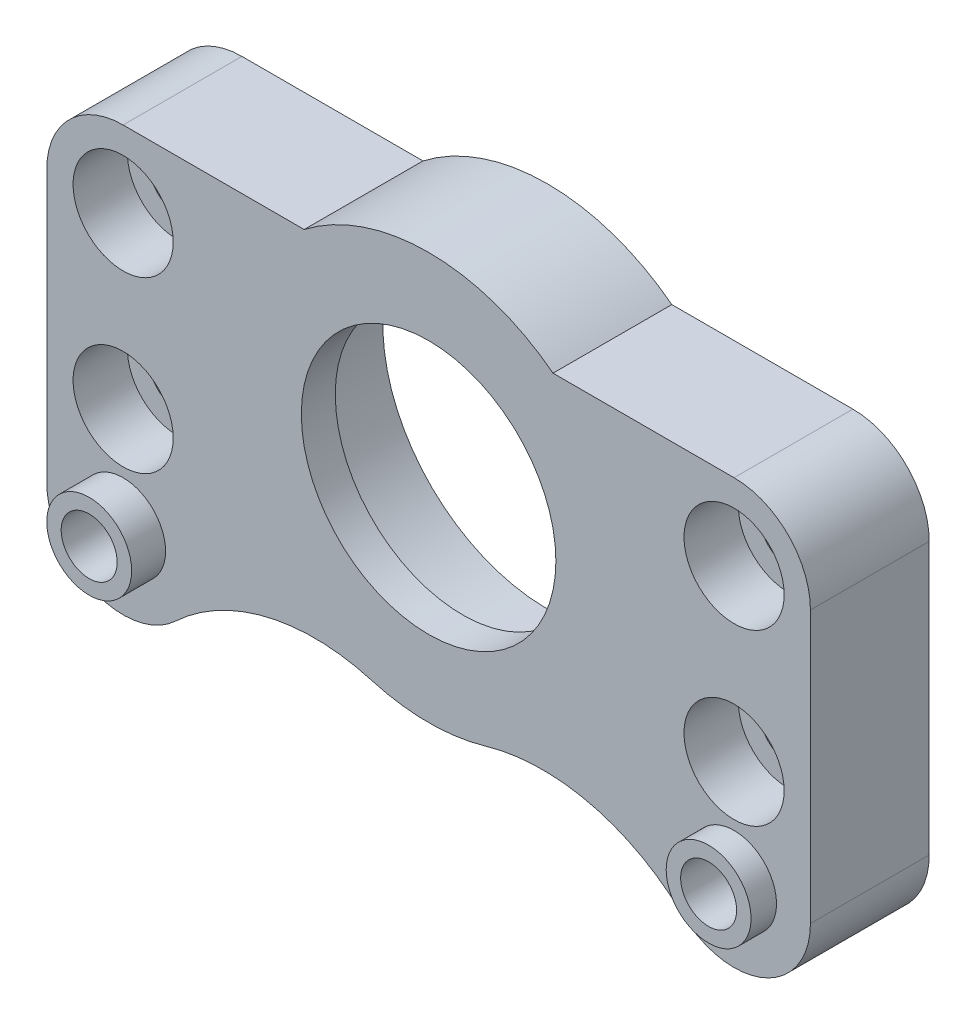
from build123d import *

# Parameters (mm, degrees)
SKETCH2_R           = 1.65
BOSS_EXTRUDE1_DEPTH = 7
SKETCH3_R           = 9.7
CUT_EXTRUDE1_DEPTH  = 5
SKETCH4_R           = 7.5
CUT_EXTRUDE2_DEPTH  = 5
CUT_EXTRUDE3_DEPTH  = 2.5
SKETCH8_R           = 2.95
CUT_EXTRUDE4_DEPTH  = 3.2
SKETCH9_R           = 2.5
SKETCH9_R_2         = 1.65
BOSS_EXTRUDE2_DEPTH = 1.5
MOVE_FACE1_BY       = 0.5


with BuildPart() as part:
    # Sketch2 → Boss-Extrude1 (new body)
    with BuildSketch(Plane.XY):
        with BuildLine():
            Line((-7.331439149, 9.5), (-18, 9.5))
            ThreePointArc((-18, 9.5), (-21.181980515, 8.181980515), (-22.5, 5))
            Line((-22.5, 5), (-22.5, -11))
            ThreePointArc((-22.5, -11), (-19.789453748, -15.128904853), (-14.92317543, -14.283770784))
            ThreePointArc((-14.92317543, -14.283770784), (-9.507484415, -11.369138817), (-3.359154955, -11.520246438))
            ThreePointArc((-3.359154955, -11.520246438), (0, -12), (3.359154955, -11.520246438))
            ThreePointArc((3.359154955, -11.520246438), (9.507484415, -11.369138817), (14.92317543, -14.283770784))
            ThreePointArc((14.92317543, -14.283770784), (19.789453748, -15.128904853), (22.5, -11))
            Line((22.5, -11), (22.5, 5))
            ThreePointArc((22.5, 5), (21.181980515, 8.181980515), (18, 9.5))
            Line((18, 9.5), (7.331439149, 9.5))
            ThreePointArc((7.331439149, 9.5), (0, 12), (-7.331439149, 9.5))
        make_face()
        with Locations((-18, 5)):
            Circle(SKETCH2_R, mode=Mode.SUBTRACT)
        with Locations((-18, -11)):
            Circle(SKETCH2_R, mode=Mode.SUBTRACT)
        with Locations((-18, -5)):
            Circle(SKETCH2_R, mode=Mode.SUBTRACT)
        with Locations((18, -5)):
            Circle(SKETCH2_R, mode=Mode.SUBTRACT)
        with Locations((18, -11)):
            Circle(SKETCH2_R, mode=Mode.SUBTRACT)
        with Locations((18, 5)):
            Circle(SKETCH2_R, mode=Mode.SUBTRACT)
    extrude(amount=BOSS_EXTRUDE1_DEPTH)

    # Sketch3 → Cut-Extrude1 (cut)
    with BuildSketch(Plane.XY):
        Circle(SKETCH3_R)
    extrude(amount=CUT_EXTRUDE1_DEPTH, mode=Mode.SUBTRACT)

    # Sketch4 → Cut-Extrude2 (cut)
    with BuildSketch(Plane(origin=(0, 0, 5), x_dir=(-1, 0, 0), z_dir=(0, 0, -1))):
        Circle(SKETCH4_R)
    extrude(amount=-CUT_EXTRUDE2_DEPTH, mode=Mode.SUBTRACT)

    # Sketch6 → Cut-Extrude3 (cut)
    with BuildSketch(Plane(origin=(0, 0, 0), x_dir=(-1, 0, 0), z_dir=(0, 0, -1))):
        Polygon((-16.325684219, -8.1), (-19.674315781, -8.1), (-21.348631561, -11), (-19.674315781, -13.9), (-16.325684219, -13.9), (-14.651368439, -11), align=None)
        Polygon((14.651368439, -11), (16.325684219, -8.1), (19.674315781, -8.1), (21.348631561, -11), (19.674315781, -13.9), (16.325684219, -13.9), align=None)
    extrude(amount=-CUT_EXTRUDE3_DEPTH, mode=Mode.SUBTRACT)

    # Sketch8 → Cut-Extrude4 (cut)
    with BuildSketch(Plane.XY.offset(7)):
        with Locations((18, -5)):
            Circle(SKETCH8_R)
        with Locations((18, 5)):
            Circle(SKETCH8_R)
        with Locations((-18, 5)):
            Circle(SKETCH8_R)
        with Locations((-18, -5)):
            Circle(SKETCH8_R)
    extrude(amount=-CUT_EXTRUDE4_DEPTH, mode=Mode.SUBTRACT)

    # Sketch9 → Boss-Extrude2 (add)
    # profile 1 of 2: a face of its own
    with BuildSketch(Plane.XY.offset(7)):
        with Locations((-18, -11)):
            Circle(SKETCH9_R)
        with Locations((-18, -11)):
            Circle(SKETCH9_R_2, mode=Mode.SUBTRACT)
    # profile 2 of 2: a face of its own
    with BuildSketch(Plane.XY.offset(7)):
        with Locations((18, -11)):
            Circle(SKETCH9_R)
        with Locations((18, -11)):
            Circle(SKETCH9_R_2, mode=Mode.SUBTRACT)
    extrude(amount=BOSS_EXTRUDE2_DEPTH)

    # Move Face1: a face moved outward by 0.5
    extrude(part.faces().sort_by_distance((-18, -13, 8.5))[0], amount=MOVE_FACE1_BY, dir=(0, 0, 1))


solid = part.part
